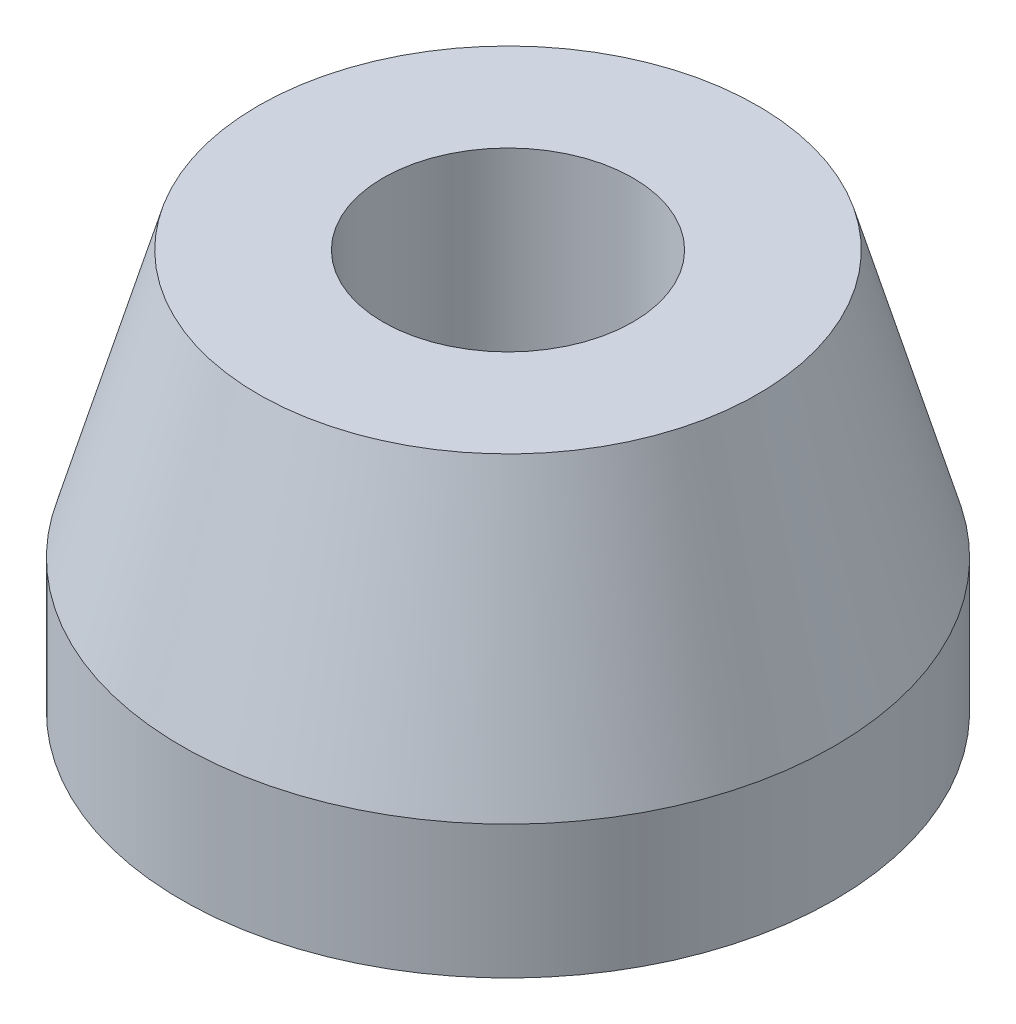
from build123d import *

# Parameters (mm, degrees)
CUT_EXTRUDE1_DEPTH      = 24.282255733
CUT_EXTRUDE1_DEPTH_BACK = 24.282255733
SKETCH2_R               = 4.7625


with BuildPart() as part:
    # Sketch1 → Revolve1 (revolve)
    with BuildSketch(Plane.XY):
        Polygon((0, 0), (-12.446, 0), (-12.446, 5.08), (-9.525, 15.24), (0, 15.24), align=None)
    revolve(axis=Axis((0, 15.24, 0), (0, -1, 0)))

    # Sketch2 → Cut-Extrude1 (cut, two sides: drawn at the far end of the back side and taken through both)
    with BuildSketch(Plane(origin=(0, 15.24, 0), x_dir=(1, 0, 0), z_dir=(0, 1, 0)).offset(-CUT_EXTRUDE1_DEPTH_BACK)):
        Circle(SKETCH2_R)
    extrude(amount=CUT_EXTRUDE1_DEPTH + CUT_EXTRUDE1_DEPTH_BACK, mode=Mode.SUBTRACT)


solid = part.part
